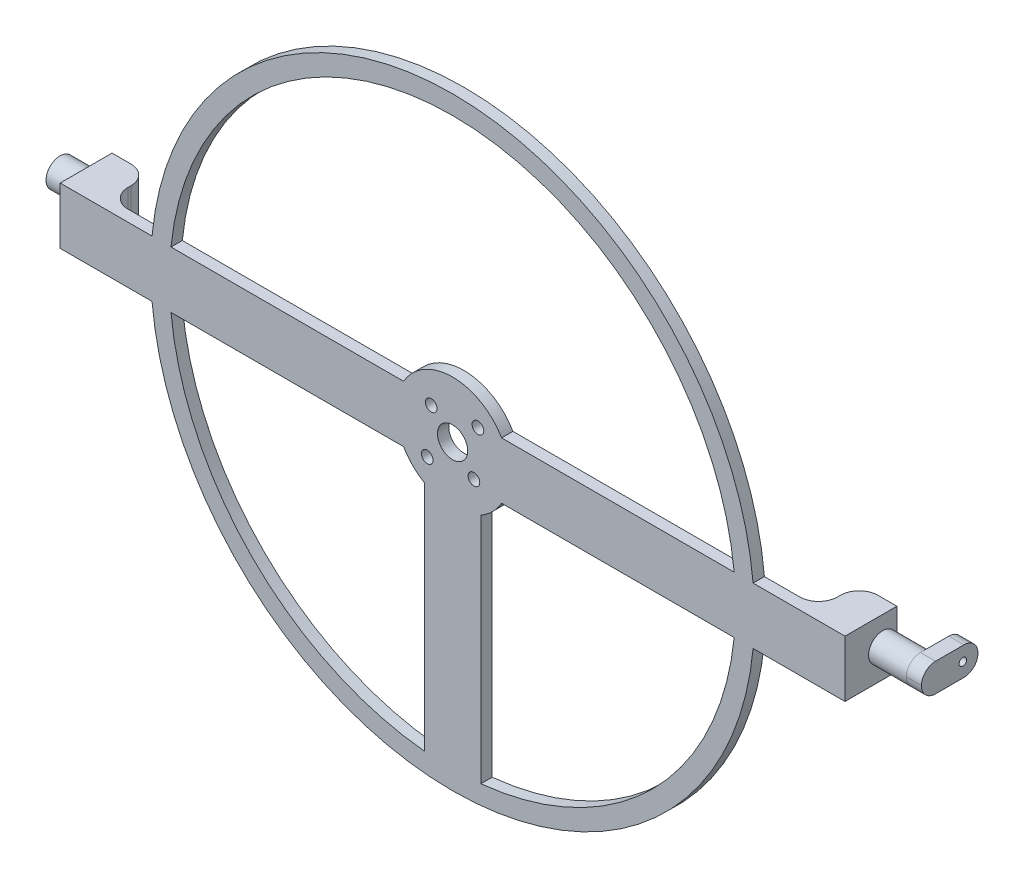
from build123d import *

# Parameters (mm, degrees)
BOSS_EXTRUDE1_DEPTH = 3
SKETCH1_3_R         = 15
BOSS_EXTRUDE2_DEPTH = 3
SKETCH2_R           = 1.55
CUT_EXTRUDE1_DEPTH  = 5
SKETCH4_R           = 3.75
BOSS_EXTRUDE3_DEPTH = 10
SKETCH3_R           = 3.75
BOSS_EXTRUDE4_DEPTH = 10
SKETCH5_W           = 15
SKETCH5_H           = 7.5
BOSS_EXTRUDE5_DEPTH = 4
FILLET2_R           = 3.75
SKETCH8_W           = 10
SKETCH8_H           = 10.75
BOSS_EXTRUDE7_DEPTH = 15
FILLET4_R           = 5
SKETCH7_W           = 10
SKETCH7_H           = 10.75
BOSS_EXTRUDE6_DEPTH = 15
FILLET3_R           = 5
SKETCH6_R           = 1
CUT_EXTRUDE4_DEPTH  = 4
SKETCH9_R           = 4
CUT_EXTRUDE5_DEPTH  = 4


with BuildPart() as part:
    # Sketch1 → Boss-Extrude1 (new body)
    with BuildSketch(Plane.XY):
        with BuildLine():
            Line((104, 7.5), (79.64766161, 7.5))
            ThreePointArc((79.64766161, 7.5), (0, 80), (-79.64766161, 7.5))
            Line((-79.64766161, 7.5), (-104, 7.5))
            Line((-104, 7.5), (-104, -7.5))
            Line((-104, -7.5), (-79.64766161, -7.5))
            ThreePointArc((-79.64766161, -7.5), (0, -80), (79.64766161, -7.5))
            Line((79.64766161, -7.5), (104, -7.5))
            Line((104, -7.5), (104, 7.5))
        make_face()
        with BuildLine():
            ThreePointArc((75, 0), (74.905955483, -3.754708129), (74.624057783, -7.5))
            ThreePointArc((74.624057783, -7.5), (53.033008589, -53.033008589), (7.5, -74.624057783))
            ThreePointArc((7.5, -74.624057783), (0, -75), (-7.5, -74.624057783))
            ThreePointArc((-7.5, -74.624057783), (-53.033008589, -53.033008589), (-74.624057783, -7.5))
            ThreePointArc((-74.624057783, -7.5), (-75, 0), (-74.624057783, 7.5))
            ThreePointArc((-74.624057783, 7.5), (0, 75), (74.624057783, 7.5))
            ThreePointArc((74.624057783, 7.5), (74.905955483, 3.754708129), (75, 0))
        make_face(mode=Mode.SUBTRACT)
    extrude(amount=BOSS_EXTRUDE1_DEPTH)

    # Sketch1<3> → Boss-Extrude2 (add)
    with BuildSketch(Plane.XY):
        with BuildLine():
            Line((-74.624057783, -7.5), (-12.990381057, -7.5))
            ThreePointArc((-12.990381057, -7.5), (-15, 0), (-12.990381057, 7.5))
            Line((-12.990381057, 7.5), (-74.624057783, 7.5))
            ThreePointArc((-74.624057783, 7.5), (-75, 0), (-74.624057783, -7.5))
        make_face()
        Circle(SKETCH1_3_R)
        with BuildLine():
            Line((7.5, -74.624057783), (7.5, -12.990381057))
            ThreePointArc((7.5, -12.990381057), (0, -15), (-7.5, -12.990381057))
            Line((-7.5, -12.990381057), (-7.5, -74.624057783))
            ThreePointArc((-7.5, -74.624057783), (0, -75), (7.5, -74.624057783))
        make_face()
        with BuildLine():
            ThreePointArc((15, 0), (14.488887394, -3.882285677), (12.990381057, -7.5))
            Line((12.990381057, -7.5), (74.624057783, -7.5))
            ThreePointArc((74.624057783, -7.5), (74.905955483, -3.754708129), (75, 0))
            ThreePointArc((75, 0), (74.905955483, 3.754708129), (74.624057783, 7.5))
            Line((74.624057783, 7.5), (12.990381057, 7.5))
            ThreePointArc((12.990381057, 7.5), (14.488887394, 3.882285677), (15, 0))
        make_face()
    extrude(amount=BOSS_EXTRUDE2_DEPTH)

    # Sketch2 → Cut-Extrude1 (cut)
    with BuildSketch(Plane.XY.offset(3)):
        with Locations((-5.656854249, 5.656854249)):
            Circle(SKETCH2_R)
        with Locations((6.717514421, 6.717514421)):
            Circle(SKETCH2_R)
        with Locations((5.656854249, -5.656854249)):
            Circle(SKETCH2_R)
        with Locations((-6.717514421, -6.717514421)):
            Circle(SKETCH2_R)
    extrude(amount=-CUT_EXTRUDE1_DEPTH, mode=Mode.SUBTRACT)



with BuildPart() as body_2:
    # Sketch4 → Boss-Extrude3 (new body)
    with BuildSketch(Plane.ZY.offset(104)):
        with Locations((-7, 0)):
            Circle(SKETCH4_R)
    extrude(amount=BOSS_EXTRUDE3_DEPTH)


with BuildPart() as body_3:
    # Sketch3 → Boss-Extrude4 (new body)
    with BuildSketch(Plane(origin=(104, 0, 0), x_dir=(0, 0, -1), z_dir=(1, 0, 0))):
        with Locations(Location((7, 0, 0), (0, 0, 180))):
            Circle(SKETCH3_R)
    extrude(amount=BOSS_EXTRUDE4_DEPTH)


with BuildPart() as body_4:
    # Sketch5 → Boss-Extrude5 (new body)
    with BuildSketch(Plane(origin=(114, 0, 0), x_dir=(0, 0, -1), z_dir=(1, 0, 0))):
        with Locations((10.75, 0)):
            Rectangle(SKETCH5_W, SKETCH5_H)
    extrude(amount=BOSS_EXTRUDE5_DEPTH)

    # Fillet2
    fillet2_edges = [body_4.edges().sort_by_distance(p)[0] for p in [
        (116, -3.75, -3.25),
        (116, 3.75, -3.25),
        (116, 3.75, -18.25),
        (116, -3.75, -18.25),
    ]]
    fillet(fillet2_edges, radius=FILLET2_R - 0.0001)  # a hair under: the kernel refuses the full size

    # Sketch6 → Cut-Extrude4 (cut)
    with BuildSketch(Plane(origin=(118, 0, 0), x_dir=(0, 0, -1), z_dir=(1, 0, 0))):
        with Locations((14.25, 0)):
            Circle(SKETCH6_R)
    extrude(amount=-CUT_EXTRUDE4_DEPTH, mode=Mode.SUBTRACT)


with BuildPart() as part_1:
    add(part.part)

    add(body_3.part)  # Boss-Extrude7 merges body 3
    # Sketch8 → Boss-Extrude7 (add)
    with BuildSketch(Plane.XZ.offset(7.5)):
        with Locations((99, -5.375)):
            Rectangle(SKETCH8_W, SKETCH8_H)
    extrude(amount=-BOSS_EXTRUDE7_DEPTH)

    # Fillet4
    fillet4_edges = [part_1.edges().sort_by_distance(p)[0] for p in [
        (94, 0, 0),
        (94, 0, -10.75),
    ]]
    fillet(fillet4_edges, radius=FILLET4_R)


    add(body_2.part)  # Boss-Extrude6 merges body 2
    # Sketch7 → Boss-Extrude6 (add)
    with BuildSketch(Plane.XZ.offset(7.5)):
        with Locations((-99, -5.375)):
            Rectangle(SKETCH7_W, SKETCH7_H)
    extrude(amount=-BOSS_EXTRUDE6_DEPTH)

    # Fillet3
    fillet3_edges = [part_1.edges().sort_by_distance(p)[0] for p in [
        (-94, 0, 0),
        (-94, 0, -10.75),
    ]]
    fillet(fillet3_edges, radius=FILLET3_R)

    # Sketch9 → Cut-Extrude5 (cut)
    with BuildSketch(Plane(origin=(0, 0, 0), x_dir=(-1, 0, 0), z_dir=(0, 0, -1))):
        Circle(SKETCH9_R)
    extrude(amount=-CUT_EXTRUDE5_DEPTH, mode=Mode.SUBTRACT)


solid = Compound([body_4.part, part_1.part])
